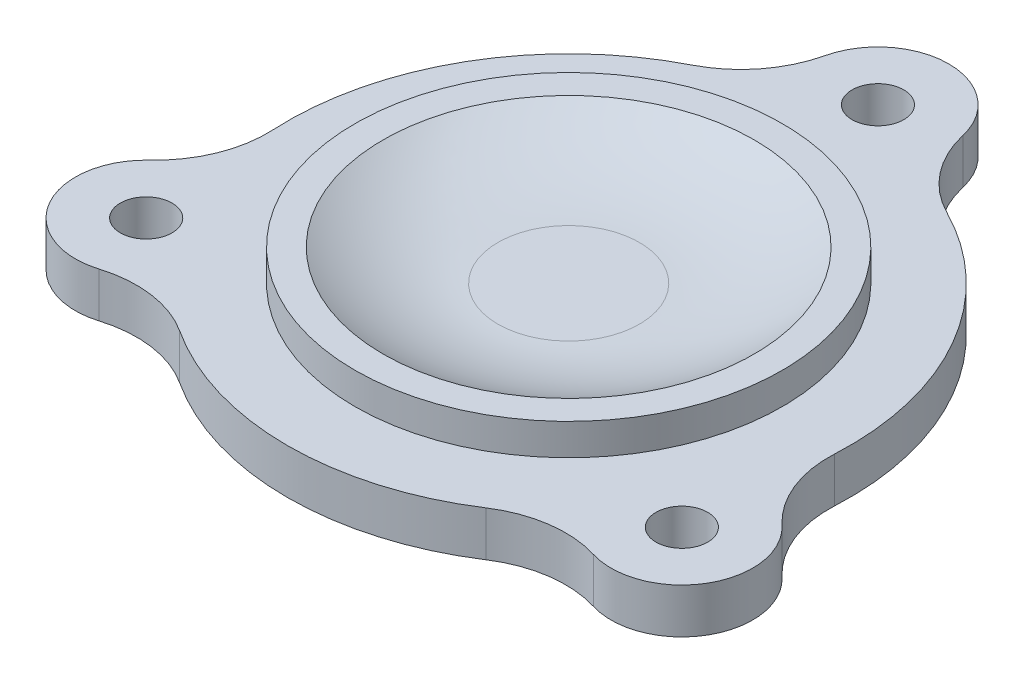
from build123d import *

# Parameters (mm, degrees)
SKETCH_1_R      = 12.5
EXTRUDE_1_DEPTH = 2
SKETCH_2_R      = 9.5
SKETCH_2_R_2    = 8.25
EXTRUDE_2_DEPTH = 1.4
FILLET_1_R      = 10
EXTRUDE_START   = -2
SKETCH_3_R      = 1.15
EXTRUDE_3_DEPTH = 2


with BuildPart() as part:
    # Эскиз1 → Бобышка-Вытянуть1 (new body)
    with BuildSketch(Plane(origin=(0, 0, 0), x_dir=(1, 0, 0), z_dir=(0, 1, 0))):
        with Locations(Location((0, 0, 0), (0, 0, 270))):
            Circle(SKETCH_1_R)
    extrude(amount=EXTRUDE_1_DEPTH)

    # Эскиз2 → Бобышка-Вытянуть2 (add)
    with BuildSketch(Plane(origin=(0, 2, 0), x_dir=(1, 0, 0), z_dir=(0, 1, 0))):
        with Locations(Location((0, 0, 0), (0, 0, 270))):
            Circle(SKETCH_2_R)
        with Locations(Location((0, 0, 0), (0, 0, 270))):
            Circle(SKETCH_2_R_2, mode=Mode.SUBTRACT)
    extrude(amount=EXTRUDE_2_DEPTH)

    # Скругление1
    # the kernel refuses this fillet: 10 mm, written as the material it adds along each edge
    with BuildSketch(Plane(origin=(0, 2, 0), x_dir=(0, 0, 1), z_dir=(-1, 0, 0))) as fillet_1_piece_1:
        with BuildLine():
            CenterArc((3.147059671, 10), FILLET_1_R, 270, 30.683417109)
            Line((3.147059671, 0), (3.147059671, -0.2))
            Line((3.147059671, -0.2), (8.25, -0.2))
            Line((8.25, -0.2), (8.45, 0))
            ThreePointArc((8.45, 0), (8.45, 0.7), (8.352058807, 1.228))
            Line((8.352058807, 1.228), (8.25, 1.4))
        make_face()
    revolve(axis=Axis((0, 2, 0), (0, 1, 0)))

    # Эскиз3 → Бобышка-Вытянуть3 (add)
    # profile 1 of 3: a face of its own
    with BuildSketch(Plane(origin=(0, 2, 0), x_dir=(1, 0, 0), z_dir=(0, 1, 0)).offset(EXTRUDE_START)):
        with BuildLine():
            ThreePointArc((5.670132274, 11.14), (0, 12.5), (-5.670132274, 11.14))
            ThreePointArc((-5.670132274, 11.14), (-4.001241708, 12.51371577), (-3.068132924, 14.463484663))
            ThreePointArc((-3.068132924, 14.463484663), (0, 16.9), (3.068132924, 14.463484663))
            ThreePointArc((3.068132924, 14.463484663), (4.001241708, 12.51371577), (5.670132274, 11.14))
        make_face()
        with Locations(Location((0, 13.75, 0), (0, 0, 270))):
            Circle(SKETCH_3_R, mode=Mode.SUBTRACT)
    # profile 2 of 3: a face of its own
    with BuildSketch(Plane(origin=(0, 2, 0), x_dir=(1, 0, 0), z_dir=(0, 1, 0)).offset(EXTRUDE_START)):
        with BuildLine():
            ThreePointArc((10.991678683, -9.888823385), (14.635829324, -8.45), (14.059811607, -4.574661277))
            ThreePointArc((14.059811607, -4.574661277), (12.837816607, -2.791680919), (12.482589135, -0.659521408))
            ThreePointArc((12.482589135, -0.659521408), (10.825317547, -6.25), (6.812456861, -10.480478592))
            ThreePointArc((6.812456861, -10.480478592), (8.836574899, -9.722034851), (10.991678683, -9.888823385))
        make_face()
        with Locations(Location((11.907849302, -6.875, 0), (0, 0, 270))):
            Circle(SKETCH_3_R, mode=Mode.SUBTRACT)
    # profile 3 of 3: a face of its own
    with BuildSketch(Plane(origin=(0, 2, 0), x_dir=(1, 0, 0), z_dir=(0, 1, 0)).offset(EXTRUDE_START)):
        with BuildLine():
            ThreePointArc((-14.059811607, -4.574661277), (-14.635829324, -8.45), (-10.991678683, -9.888823385))
            ThreePointArc((-10.991678683, -9.888823385), (-8.836574899, -9.722034851), (-6.812456861, -10.480478592))
            ThreePointArc((-6.812456861, -10.480478592), (-10.825317547, -6.25), (-12.482589135, -0.659521408))
            ThreePointArc((-12.482589135, -0.659521408), (-12.837816607, -2.791680919), (-14.059811607, -4.574661277))
        make_face()
        with Locations(Location((-11.907849302, -6.875, 0), (0, 0, 270))):
            Circle(SKETCH_3_R, mode=Mode.SUBTRACT)
    extrude(amount=EXTRUDE_3_DEPTH)


solid = part.part
